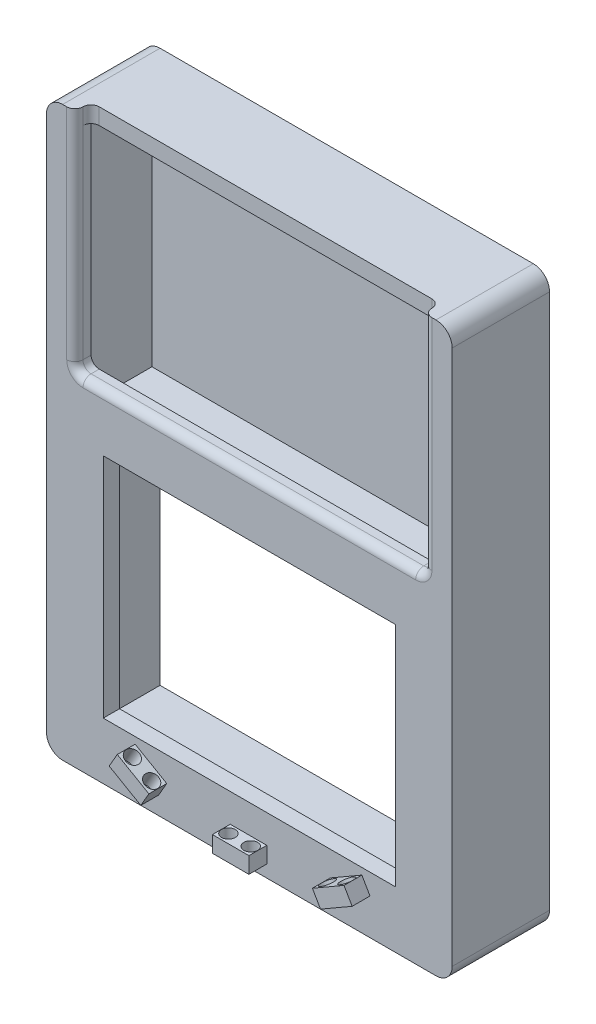
from build123d import *

# Parameters (mm, degrees)
SCHIZZO1_W                     = 500
SCHIZZO1_H                     = 700
ESTRUSIONE_ESTRUSIONE4_DEPTH   = 20
SCHIZZO1_4_W                   = 500
SCHIZZO1_4_H                   = 700
SCHIZZO1_4_W_2                 = 460
SCHIZZO1_4_H_2                 = 660
ESTRUSIONE_ESTRUSIONE5_DEPTH   = 100
ESTRUSIONE_ESTRUSIONE6_START   = 20
ESTRUSIONE_ESTRUSIONE6_DEPTH   = 22
SCHIZZO2_W                     = 45
SCHIZZO2_H                     = 20
ESTRUSIONE_ESTRUSIONE6_2_DEPTH = 22
ESTRUSIONE_ESTRUSIONE7_START   = 20
ESTRUSIONE_ESTRUSIONE7_DEPTH   = 22
SCHIZZO6_R                     = 8.5
TAGLIO_ESTRUSIONE1_DEPTH       = 22
SCHIZZO7_R                     = 8.5
TAGLIO_ESTRUSIONE2_DEPTH       = 22
SCHIZZO8_R                     = 8.5
TAGLIO_ESTRUSIONE3_DEPTH       = 22
SCHIZZO10_W                    = 360
SCHIZZO10_H                    = 280
TAGLIO_ESTRUSIONE4_DEPTH       = 22
RACCORDO1_R                    = 20
RACCORDO2_R                    = 20
RACCORDO3_R                    = 20
RACCORDO4_R                    = 20
SCHIZZO11_W                    = 460
SCHIZZO11_H                    = 15
ESTRUSIONE_ESTRUSIONE8_DEPTH   = 100
SCHIZZO11_3_W                  = 460
SCHIZZO11_3_H                  = 315
ESTRUSIONE_ESTRUSIONE9_DEPTH   = 10
TAGLIO_ESTRUSIONE5_DEPTH       = 20
RACCORDO5_R                    = 10
RACCORDO6_R                    = 10
RACCORDO7_R                    = 10
RACCORDO8_R                    = 10
RACCORDO9_R                    = 10


with BuildPart() as part:
    # Schizzo1 → Estrusione-Estrusione4 (new body)
    with BuildSketch(Plane.XY):
        with Locations((250, -350)):
            Rectangle(SCHIZZO1_W, SCHIZZO1_H)
    extrude(amount=ESTRUSIONE_ESTRUSIONE4_DEPTH)

    # Schizzo1<4> → Estrusione-Estrusione5 (add)
    with BuildSketch(Plane.XY):
        with Locations((250, -350)):
            Rectangle(SCHIZZO1_4_W, SCHIZZO1_4_H)
        with Locations((250, -350)):
            Rectangle(SCHIZZO1_4_W_2, SCHIZZO1_4_H_2, mode=Mode.SUBTRACT)
    extrude(amount=-ESTRUSIONE_ESTRUSIONE5_DEPTH)

    # Schizzo2<3> → Estrusione-Estrusione7 (add)
    with BuildSketch(Plane.XY.offset(ESTRUSIONE_ESTRUSIONE7_START)):
        Polygon((359.75, -677.989883085), (398.72114317, -655.489883085), (388.72114317, -638.169375009), (349.75, -660.669375009), align=None)
    extrude(amount=ESTRUSIONE_ESTRUSIONE7_DEPTH)

    # Schizzo8 → Taglio-Estrusione3 (cut)
    with BuildSketch(Plane(origin=(383.51573113, -664.26873182, 0), x_dir=(0.8660254037844405, 0.49999999999999684, 0), z_dir=(0.49999999999999684, -0.8660254037844405, 0))):
        with Locations((-18.692302531, 31)):
            Circle(SCHIZZO8_R)
        with Locations((8.807697469, 31)):
            Circle(SCHIZZO8_R)
    extrude(amount=-TAGLIO_ESTRUSIONE3_DEPTH, mode=Mode.SUBTRACT)

    # Schizzo10 → Taglio-Estrusione4 (cut)
    with BuildSketch(Plane.XY.offset(20)):
        with Locations((250, -490)):
            Rectangle(SCHIZZO10_W, SCHIZZO10_H)
    extrude(amount=-TAGLIO_ESTRUSIONE4_DEPTH, mode=Mode.SUBTRACT)

    # Raccordo1
    raccordo1_edges = [part.edges().sort_by_distance(p)[0] for p in [
        (0, 0, -40),
    ]]
    fillet(raccordo1_edges, radius=RACCORDO1_R)

    # Raccordo2
    raccordo2_edges = [part.edges().sort_by_distance(p)[0] for p in [
        (500, 0, -40),
    ]]
    fillet(raccordo2_edges, radius=RACCORDO2_R)

    # Raccordo3
    raccordo3_edges = [part.edges().sort_by_distance(p)[0] for p in [
        (500, -700, -40),
    ]]
    fillet(raccordo3_edges, radius=RACCORDO3_R)

    # Raccordo4
    raccordo4_edges = [part.edges().sort_by_distance(p)[0] for p in [
        (0, -700, -40),
    ]]
    fillet(raccordo4_edges, radius=RACCORDO4_R)

    # Schizzo11 → Estrusione-Estrusione8 (add)
    with BuildSketch(Plane(origin=(0, 0, -100), x_dir=(-1, 0, 0), z_dir=(0, 0, -1))):
        with Locations((-250, -342.5)):
            Rectangle(SCHIZZO11_W, SCHIZZO11_H)
    extrude(amount=-ESTRUSIONE_ESTRUSIONE8_DEPTH)

    # Schizzo11<3> → Estrusione-Estrusione9 (add)
    with BuildSketch(Plane(origin=(0, 0, -100), x_dir=(-1, 0, 0), z_dir=(0, 0, -1))):
        with Locations((-250, -177.5)):
            Rectangle(SCHIZZO11_3_W, SCHIZZO11_3_H)
    extrude(amount=-ESTRUSIONE_ESTRUSIONE9_DEPTH)

    # Schizzo12 → Taglio-Estrusione5 (cut)
    with BuildSketch(Plane.XY.offset(20)):
        Polygon((35, -35), (35, 0), (465, 0), (465, -35), (465, -280), (35, -280), align=None)
    extrude(amount=-TAGLIO_ESTRUSIONE5_DEPTH, mode=Mode.SUBTRACT)

    # Raccordo5
    raccordo5_edges = [part.edges().sort_by_distance(p)[0] for p in [
        (35, -280, 10),
    ]]
    fillet(raccordo5_edges, radius=RACCORDO5_R)

    # Raccordo6
    raccordo6_edges = [part.edges().sort_by_distance(p)[0] for p in [
        (465, -280, 10),
    ]]
    fillet(raccordo6_edges, radius=RACCORDO6_R)

    # Raccordo7
    # the kernel refuses this fillet: 10 mm, written as the material it adds along each edge
    with BuildSketch(Plane(origin=(465, -20, 0), x_dir=(0, 0, 1), z_dir=(0, 1, 0))) as raccordo7_piece_1:
        with BuildLine():
            CenterArc((RACCORDO7_R, -RACCORDO7_R), RACCORDO7_R, 90, 90)
            Line((0, -RACCORDO7_R), (0, 0))
            Line((0, 0), (RACCORDO7_R, 0))
        make_face()
    extrude(amount=20)

    # Raccordo8
    # the kernel refuses this fillet: 10 mm, written as the material it adds along each edge
    with BuildSketch(Plane(origin=(35, 0, 0), x_dir=(1, 0, 0), z_dir=(0, -1, 0))) as raccordo8_piece_1:
        with BuildLine():
            CenterArc((RACCORDO8_R, RACCORDO8_R), RACCORDO8_R, 180, 90)
            Line((0, RACCORDO8_R), (0, 0))
            Line((0, 0), (RACCORDO8_R, 0))
        make_face()
    extrude(amount=20)

    # Raccordo9
    raccordo9_edges = [part.edges().sort_by_distance(p)[0] for p in [
        (35, -135, 20),
        (250, -280, 20),
        (37.928932188, -277.071067812, 20),
        (465, -135, 20),
        (462.071067812, -277.071067812, 20),
    ]]
    fillet(raccordo9_edges, radius=RACCORDO9_R)


with BuildPart() as body_2:
    # Schizzo2 → Estrusione-Estrusione6 (new body)
    with BuildSketch(Plane.XY.offset(ESTRUSIONE_ESTRUSIONE6_START)):
        Polygon((148.250287501, -660.670038978), (138.249137563, -677.989883085), (99.279144353, -655.490547015), (109.279144331, -638.170038978), align=None)
    extrude(amount=ESTRUSIONE_ESTRUSIONE6_DEPTH)

    # Schizzo6 → Taglio-Estrusione1 (cut)
    with BuildSketch(Plane(origin=(-259.01594674, -448.628779724, 0), x_dir=(0.8660254037844389, -0.49999999999999967, 0), z_dir=(-0.49999999999999967, -0.8660254037844389, 0))):
        with Locations((422.472870653, 31)):
            Circle(SCHIZZO6_R)
        with Locations((449.972870653, 31)):
            Circle(SCHIZZO6_R)
    extrude(amount=-TAGLIO_ESTRUSIONE1_DEPTH, mode=Mode.SUBTRACT)


with BuildPart() as body_3:
    # Schizzo2 → Estrusione-Estrusione6 2 (new body)
    with BuildSketch(Plane.XY.offset(ESTRUSIONE_ESTRUSIONE6_START)):
        with Locations((249, -675)):
            Rectangle(SCHIZZO2_W, SCHIZZO2_H)
    extrude(amount=ESTRUSIONE_ESTRUSIONE6_2_DEPTH)

    # Schizzo7 → Taglio-Estrusione2 (cut)
    with BuildSketch(Plane.XZ.offset(685)):
        with Locations(Location((235.25, 31, 0), (0, 0, 270))):
            Circle(SCHIZZO7_R)
        with Locations(Location((262.75, 31, 0), (0, 0, 270))):
            Circle(SCHIZZO7_R)
    extrude(amount=-TAGLIO_ESTRUSIONE2_DEPTH, mode=Mode.SUBTRACT)


solid = Compound([part.part, body_2.part, body_3.part])
